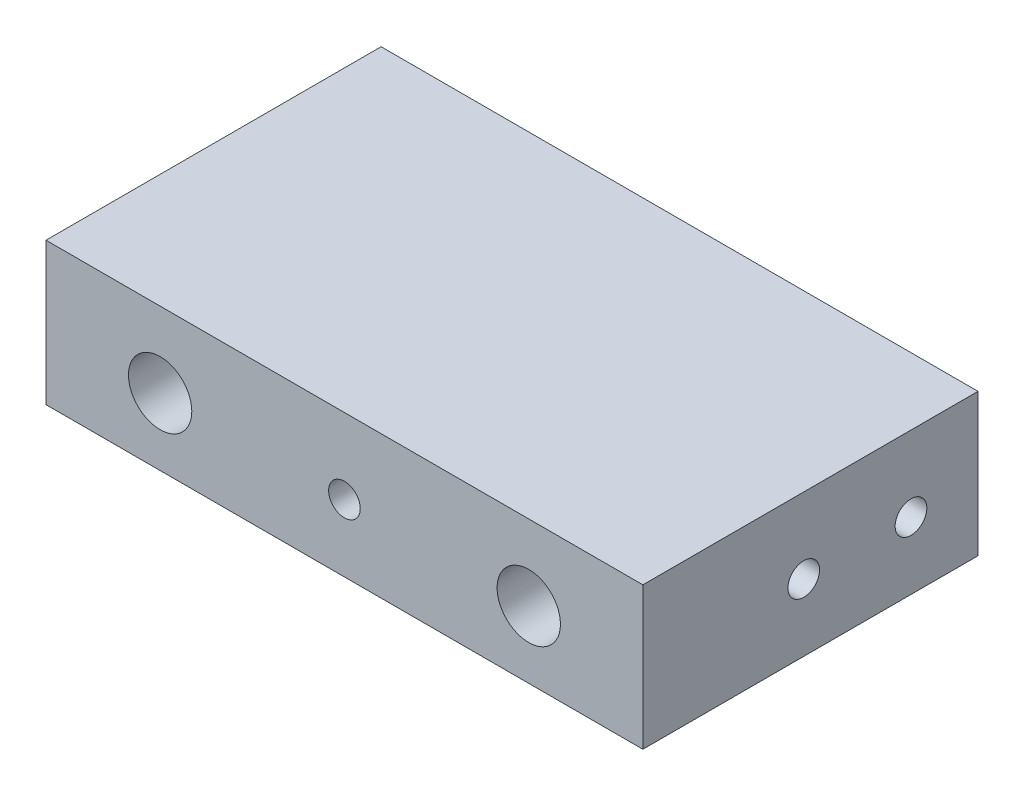
from build123d import *

# Parameters (mm, degrees)
SKETCH1_W           = 56.55
SKETCH1_H           = 12.7
BOSS_EXTRUDE1_DEPTH = 31.75
SKETCH2_R           = 3
SKETCH2_R_2         = 1.5
CUT_EXTRUDE1_DEPTH  = 10
SKETCH3_R           = 1.5
CUT_EXTRUDE2_DEPTH  = 66.163544256
SKETCH4_W           = 56.55
SKETCH4_H           = 31.75
BOSS_EXTRUDE2_DEPTH = 0.79375


with BuildPart() as part:
    # Sketch1 → Boss-Extrude1 (new body)
    with BuildSketch(Plane.XY):
        Rectangle(SKETCH1_W, SKETCH1_H)
    extrude(amount=BOSS_EXTRUDE1_DEPTH)

    # Sketch2 → Cut-Extrude1 (cut)
    with BuildSketch(Plane.XY.offset(31.75)):
        with Locations((17.4625, 0)):
            Circle(SKETCH2_R)
        with Locations((-17.4625, 0)):
            Circle(SKETCH2_R)
        Circle(SKETCH2_R_2)
    extrude(amount=-CUT_EXTRUDE1_DEPTH, mode=Mode.SUBTRACT)

    # Sketch3 → Cut-Extrude2 (cut, through all)
    with BuildSketch(Plane.ZY.offset(28.275)):
        with Locations((16.51, 0)):
            Circle(SKETCH3_R)
        with Locations((6.35, 0)):
            Circle(SKETCH3_R)
    extrude(amount=-CUT_EXTRUDE2_DEPTH, mode=Mode.SUBTRACT)

    # Sketch4 → Boss-Extrude2 (add)
    with BuildSketch(Plane(origin=(0, 6.35, 0), x_dir=(1, 0, 0), z_dir=(0, 1, 0))):
        with Locations((0, -15.875)):
            Rectangle(SKETCH4_W, SKETCH4_H)
    extrude(amount=BOSS_EXTRUDE2_DEPTH)


solid = part.part
